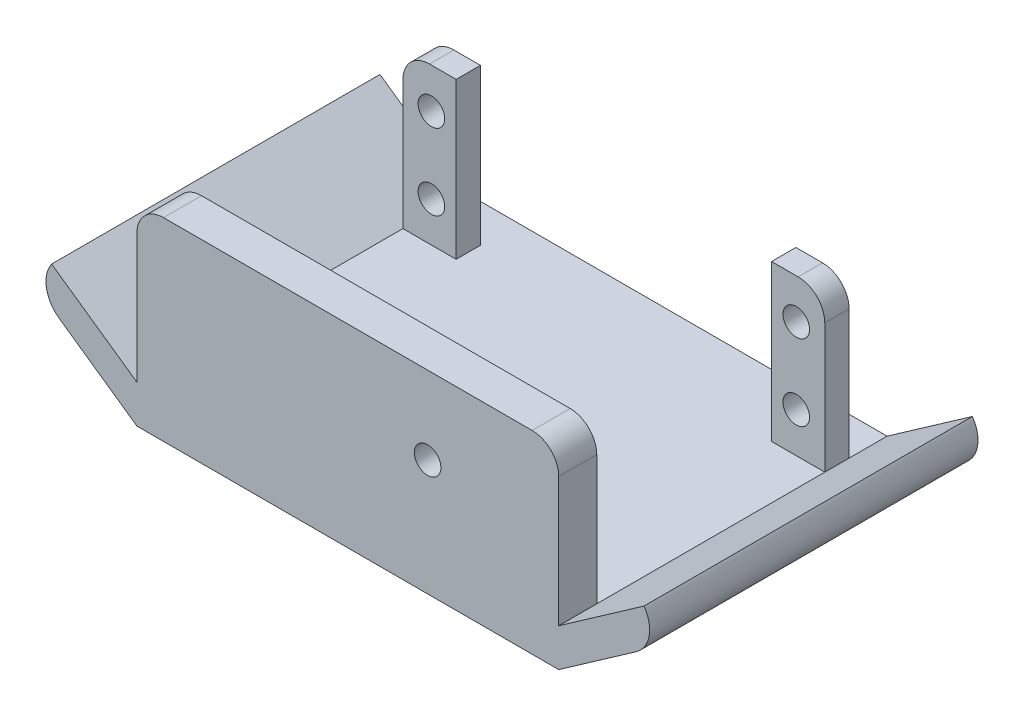
from build123d import *

# Parameters (mm, degrees)
SKETCH1_W            = 55.5
SKETCH1_H            = 43.2
BASE_DEPTH           = 5
SKETCH2_W            = 55.5
SKETCH2_H            = 25.5
WALL_DEPTH           = 5
SKETCH3_W            = 7
SKETCH3_H            = 20.5
MOUNTINGTABS_DEPTH   = 5
LIPS_REACH           = 76.811
SKETCH5_R            = 1.75
MOUNTINGHOLES_DEPTH  = 5
FILLETS_R            = 3.5
SKETCH6_R            = 1.75
THROUGHHOLE_DEPTH    = 5
MIRROR1_START        = -40
MIRROR1_OUTLINE_R    = 1.75
MIRROR1_DEPTH        = 1.8
MIRROR1_START_2      = -38.2
MIRROR1_2_OUTLINE_R  = 1.75
MIRROR1_2_DEPTH      = 3.2
FILLETS_OF_MIRROR2_R = 3.5
CUT_EXTRUDE2_DEPTH   = 5
CUT_EXTRUDE3_DEPTH   = 3.2


# Read off the part's stored shape, not the designer's step: Mirror1
with BuildPart() as part:
    # Sketch1 → base (new body)
    with BuildSketch(Plane(origin=(0, 0, 0), x_dir=(1, 0, 0), z_dir=(0, 1, 0))):
        with Locations((27.75, 21.6)):
            Rectangle(SKETCH1_W, SKETCH1_H)
    extrude(amount=BASE_DEPTH)

    # Sketch2 → wall (add)
    with BuildSketch(Plane(origin=(0, 0, -43.2), x_dir=(-1, 0, 0), z_dir=(0, 0, -1))):
        with Locations((-27.75, 12.75)):
            Rectangle(SKETCH2_W, SKETCH2_H)
    wall = extrude(amount=-WALL_DEPTH)

    # Sketch3 → mountingTabs (add)
    with BuildSketch(Plane.XY.offset(-8.2)):
        with Locations((3.5, 15.25)):
            Rectangle(SKETCH3_W, SKETCH3_H)
        with Locations((52, 15.25)):
            Rectangle(SKETCH3_W, SKETCH3_H)
    extrude(amount=MOUNTINGTABS_DEPTH)

    # lips: up to this face of the body (flat: up to its plane)
    lips_end = Plane(part.part.faces().sort_by_distance((27.75, 12.75, -43.2))[0])
    # Sketch4 → lips (add, up to the picked face)
    with BuildSketch(Plane.XY, mode=Mode.PRIVATE) as lips_sk1:
        with BuildLine():
            Line((0, 0), (-10.208884478, 7.148337868))
            ThreePointArc((-10.208884478, 7.148337868), (-11.894564223, 9.792816133), (-11.218174515, 12.85505036))
            Line((-11.218174515, 12.85505036), (0, 5))
            Line((0, 5), (0, 0))
        make_face()
    lips_tool1 = split(extrude(lips_sk1.sketch, amount=-LIPS_REACH, mode=Mode.PRIVATE), bisect_by=lips_end, keep=Keep.BOTH, mode=Mode.PRIVATE)
    # Sketch4 → lips (add, up to the picked face)
    with BuildSketch(Plane.XY, mode=Mode.PRIVATE) as lips_sk2:
        with BuildLine():
            Line((55.5, 5), (66.718174515, 12.85505036))
            ThreePointArc((66.718174515, 12.85505036), (67.394564223, 9.792816133), (65.708884478, 7.148337868))
            Line((65.708884478, 7.148337868), (55.5, 0))
            Line((55.5, 0), (55.5, 5))
        make_face()
    lips_tool2 = split(extrude(lips_sk2.sketch, amount=-LIPS_REACH, mode=Mode.PRIVATE), bisect_by=lips_end, keep=Keep.BOTH, mode=Mode.PRIVATE)
    add(lips_tool1.solids().sort_by(Axis((-5.839287, 6.590277, 0), (0, 0, -1)))[0])
    add(lips_tool2.solids().sort_by(Axis((61.339287, 6.590277, 0), (0, 0, -1)))[0])

    # Sketch5 → mountingHoles (cut)
    with BuildSketch(Plane.XY.offset(-3.2)):
        with Locations((3.75, 20.25)):
            Circle(SKETCH5_R)
        with Locations(Location((3.75, 10.25, 0), (0, 0, 180))):
            Circle(SKETCH5_R)
        with Locations((51.75, 10.25)):
            Circle(SKETCH5_R)
        with Locations(Location((51.75, 20.25, 0), (0, 0, 180))):
            Circle(SKETCH5_R)
    extrude(amount=-MOUNTINGHOLES_DEPTH, mode=Mode.SUBTRACT)

    # fillets
    fillets_edges = [part.edges().sort_by_distance(p)[0] for p in [
        (0, 25.5, -40.7),
        (55.5, 25.5, -40.7),
        (0, 25.5, -5.7),
        (55.5, 25.5, -5.7),
    ]]
    fillet(fillets_edges, radius=FILLETS_R)

    # Sketch6 → throughHole (cut)
    with BuildSketch(Plane.XY.offset(-38.2)):
        with Locations((38.25, 15.25)):
            Circle(SKETCH6_R)
    throughhole = extrude(amount=-THROUGHHOLE_DEPTH, mode=Mode.SUBTRACT)

    # Mirror1 outline → Mirror1 (cut)
    with BuildSketch(Plane.XY.offset(MIRROR1_START)):
        with Locations((51.75, 10.25)):
            Circle(MIRROR1_OUTLINE_R)
        with Locations((51.75, 20.25)):
            Circle(MIRROR1_OUTLINE_R)
        with Locations((3.75, 20.25)):
            Circle(MIRROR1_OUTLINE_R)
        with Locations((3.75, 10.25)):
            Circle(MIRROR1_OUTLINE_R)
    extrude(amount=MIRROR1_DEPTH, mode=Mode.SUBTRACT)

    # Mirror1 2 outline → Mirror1 2 (add)
    # profile 1 of 2: a face of its own
    with BuildSketch(Plane.XY.offset(MIRROR1_START_2)):
        with BuildLine():
            ThreePointArc((55.5, 22), (54.474873734, 24.474873734), (52, 25.5))
            Line((52, 25.5), (48.5, 25.5))
            Line((48.5, 25.5), (48.5, 5))
            Line((48.5, 5), (55.5, 5))
            Line((55.5, 5), (55.5, 22))
        make_face()
        with Locations((51.75, 10.25)):
            Circle(MIRROR1_2_OUTLINE_R, mode=Mode.SUBTRACT)
        with Locations((51.75, 20.25)):
            Circle(MIRROR1_2_OUTLINE_R, mode=Mode.SUBTRACT)
    # profile 2 of 2: a face of its own
    with BuildSketch(Plane.XY.offset(MIRROR1_START_2)):
        with BuildLine():
            Line((7, 5), (7, 25.5))
            Line((7, 25.5), (3.5, 25.5))
            ThreePointArc((3.5, 25.5), (1.025126266, 24.474873734), (0, 22))
            Line((0, 22), (0, 5))
            Line((0, 5), (7, 5))
        make_face()
        with Locations((3.75, 10.25)):
            Circle(MIRROR1_2_OUTLINE_R, mode=Mode.SUBTRACT)
        with Locations((3.75, 20.25)):
            Circle(MIRROR1_2_OUTLINE_R, mode=Mode.SUBTRACT)
    extrude(amount=MIRROR1_2_DEPTH)

    # Mirror2: wall, throughHole across plane
    add(wall.mirror(Plane(origin=(0, 0, -21.6), x_dir=(1, 0, 0), z_dir=(0, 0, -1))))
    add(throughhole.mirror(Plane(origin=(0, 0, -21.6), x_dir=(1, 0, 0), z_dir=(0, 0, -1))), mode=Mode.SUBTRACT)

    # fillets of Mirror2
    fillets_of_mirror2_edges = [part.edges().sort_by_distance(p)[0] for p in [
        (0, 25.5, -2.5),
        (55.5, 25.5, -2.5),
        (0, 25.5, -37.5),
        (55.5, 25.5, -37.5),
    ]]
    fillet(fillets_of_mirror2_edges, radius=FILLETS_OF_MIRROR2_R)

    # Sketch7 → Cut-Extrude2 (cut)
    with BuildSketch(Plane(origin=(0, 0, -43.2), x_dir=(-1, 0, 0), z_dir=(0, 0, -1))):
        with BuildLine():
            Line((-55.5, 5), (0, 5))
            Line((0, 5), (0, 22))
            ThreePointArc((0, 22), (-1.025126266, 24.474873734), (-3.5, 25.5))
            Line((-3.5, 25.5), (-52, 25.5))
            ThreePointArc((-52, 25.5), (-54.474873734, 24.474873734), (-55.5, 22))
            Line((-55.5, 22), (-55.5, 5))
        make_face()
    extrude(amount=-CUT_EXTRUDE2_DEPTH, mode=Mode.SUBTRACT)

    # Sketch8 → Cut-Extrude3 (cut)
    with BuildSketch(Plane(origin=(0, 0, -8.2), x_dir=(-1, 0, 0), z_dir=(0, 0, -1))):
        with BuildLine():
            Line((-48.5, 25.5), (-52, 25.5))
            ThreePointArc((-52, 25.5), (-54.474873734, 24.474873734), (-55.5, 22))
            Line((-55.5, 22), (-55.5, 5))
            Line((-55.5, 5), (-48.5, 5))
            Line((-48.5, 5), (-48.5, 25.5))
        make_face()
        with BuildLine():
            Line((0, 5), (0, 22))
            ThreePointArc((0, 22), (-1.025126266, 24.474873734), (-3.5, 25.5))
            Line((-3.5, 25.5), (-7, 25.5))
            Line((-7, 25.5), (-7, 5))
            Line((-7, 5), (0, 5))
        make_face()
    extrude(amount=-CUT_EXTRUDE3_DEPTH, mode=Mode.SUBTRACT)


solid = part.part
